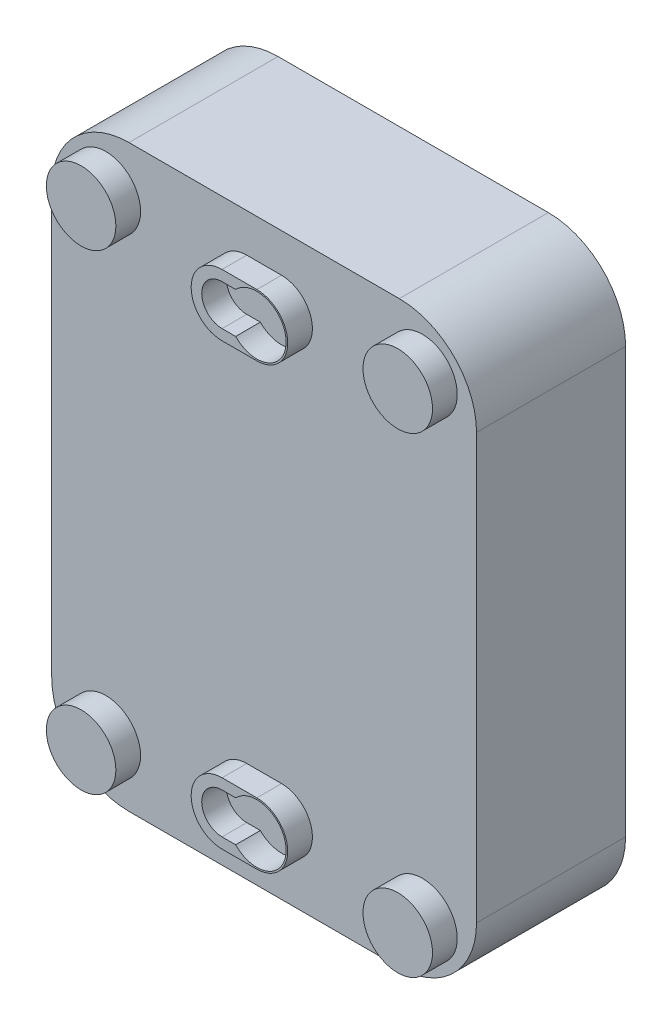
from build123d import *

# Parameters (mm, degrees)
SKETCH1_W           = 69.85
SKETCH1_H           = 95.25
BOSS_EXTRUDE1_DEPTH = 28.575
FILLET1_R           = 12.7
SKETCH2_OUTSIDE_W   = 96.154
SKETCH2_OUTSIDE_H   = 121.554
SKETCH2_OUTSIDE_R   = 5.715
CUT_EXTRUDE1_DEPTH  = 4.064


with BuildPart() as part:
    # Sketch1 → Boss-Extrude1 (new body)
    with BuildSketch(Plane.XY):
        with Locations((34.925, 47.625)):
            Rectangle(SKETCH1_W, SKETCH1_H)
    extrude(amount=BOSS_EXTRUDE1_DEPTH)

    # Fillet1
    fillet1_edges = [part.edges().sort_by_distance(p)[0] for p in [
        (0, 0, 14.2875),
        (69.85, 0, 14.2875),
        (69.85, 95.25, 14.2875),
        (0, 95.25, 14.2875),
    ]]
    fillet(fillet1_edges, radius=FILLET1_R)

    # Sketch2 outside → Cut-Extrude1 (cut)
    # profile 1 of 3: a face of its own
    with BuildSketch(Plane.XY.offset(28.575)):
        with Locations((34.925, 47.625)):
            Rectangle(SKETCH2_OUTSIDE_W, SKETCH2_OUTSIDE_H)
        with Locations((60.96, 8.89)):
            Circle(SKETCH2_OUTSIDE_R, mode=Mode.SUBTRACT)
        with Locations((8.89, 8.89)):
            Circle(SKETCH2_OUTSIDE_R, mode=Mode.SUBTRACT)
        with Locations((8.89, 86.36)):
            Circle(SKETCH2_OUTSIDE_R, mode=Mode.SUBTRACT)
        with Locations((60.96, 86.36)):
            Circle(SKETCH2_OUTSIDE_R, mode=Mode.SUBTRACT)
        with BuildLine():
            Line((37.7825, 6.35), (32.0675, 6.35))
            ThreePointArc((32.0675, 6.35), (26.9875, 11.43), (32.0675, 16.51))
            Line((32.0675, 16.51), (37.7825, 16.51))
            ThreePointArc((37.7825, 16.51), (42.8625, 11.43), (37.7825, 6.35))
        make_face(mode=Mode.SUBTRACT)
        with BuildLine():
            Line((37.7825, 78.74), (32.0675, 78.74))
            ThreePointArc((32.0675, 78.74), (26.9875, 83.82), (32.0675, 88.9))
            Line((32.0675, 88.9), (37.7825, 88.9))
            ThreePointArc((37.7825, 88.9), (42.8625, 83.82), (37.7825, 78.74))
        make_face(mode=Mode.SUBTRACT)
    # profile 2 of 3: a face of its own
    with BuildSketch(Plane.XY.offset(28.575)):
        with BuildLine():
            Line((32.0675, 14.77282006), (34.301719909, 14.77282006))
            ThreePointArc((34.301719909, 14.77282006), (42.6085, 11.43), (34.301719909, 8.08717994))
            Line((34.301719909, 8.08717994), (32.0675, 8.08717994))
            ThreePointArc((32.0675, 8.08717994), (28.72467994, 11.43), (32.0675, 14.77282006))
        make_face()
    # profile 3 of 3: a face of its own
    with BuildSketch(Plane.XY.offset(28.575)):
        with BuildLine():
            Line((32.0675, 80.47717994), (34.301719909, 80.47717994))
            ThreePointArc((34.301719909, 80.47717994), (42.6085, 83.82), (34.301719909, 87.16282006))
            Line((34.301719909, 87.16282006), (32.0675, 87.16282006))
            ThreePointArc((32.0675, 87.16282006), (28.72467994, 83.82), (32.0675, 80.47717994))
        make_face()
    extrude(amount=-CUT_EXTRUDE1_DEPTH, mode=Mode.SUBTRACT)


solid = part.part
